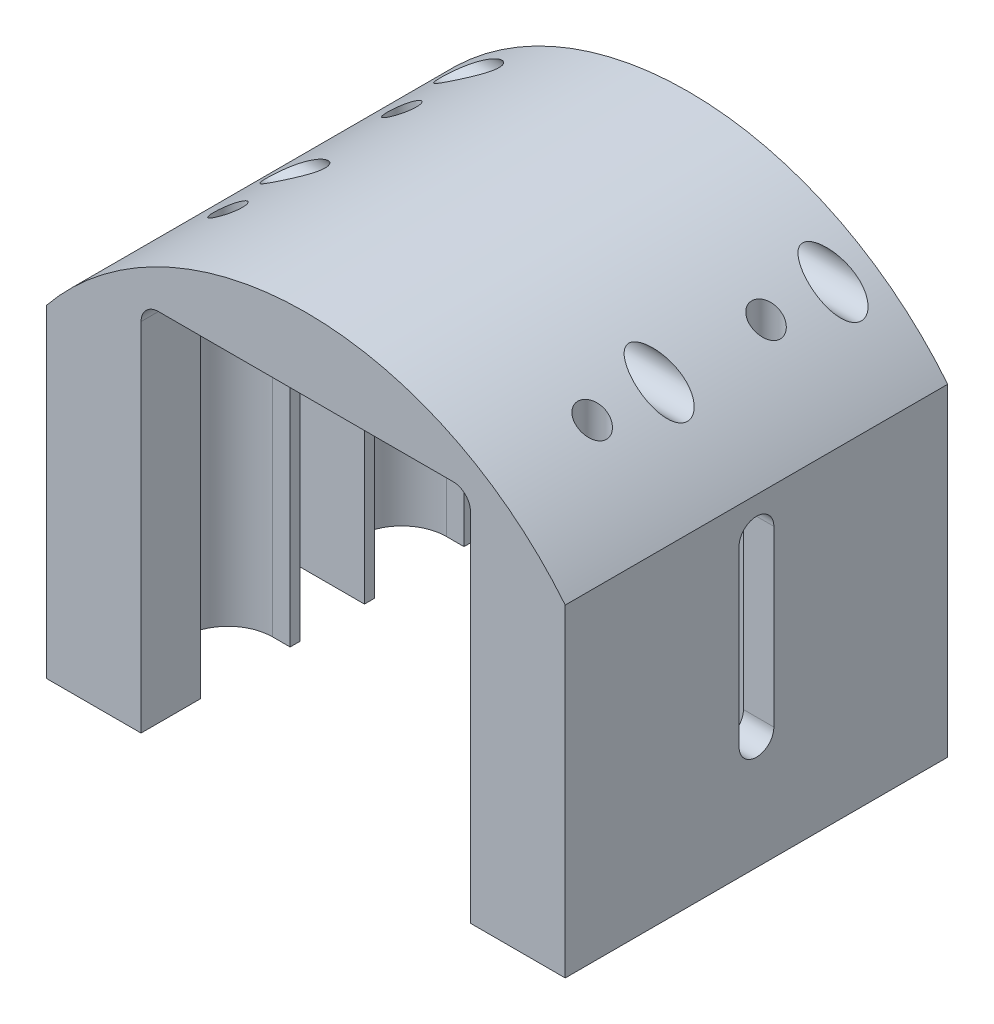
from build123d import *

# Parameters (mm, degrees)
BOSS_EXTRUDE1_DEPTH     = 44
CUT_EXTRUDE1_DEPTH      = 66.586450582
SKETCH4_W               = 7.4
SKETCH4_H               = 7.4
CUT_EXTRUDE2_DEPTH      = 38
CUT_EXTRUDE4_DEPTH      = 66.586450582
CUT_EXTRUDE4_DEPTH_BACK = 66.586450582
BOSS_EXTRUDE2_START     = -48.736492
BOSS_EXTRUDE2_DEPTH     = 37.772984
CUT_EXTRUDE5_DEPTH      = 84.514370074
SKETCH8_R               = 1.65
CUT_EXTRUDE6_DEPTH      = 66.353060485


with BuildPart() as part:
    # Sketch1 → Boss-Extrude1 (new body)
    with BuildSketch(Plane.XY):
        with BuildLine():
            Line((29.85, -13), (29.85, 24.156520859))
            ThreePointArc((29.85, 24.156520859), (0, 38.4), (-29.85, 24.156520859))
            Line((-29.85, 24.156520859), (-29.85, -13))
            Line((-29.85, -13), (29.85, -13))
        make_face()
    extrude(amount=BOSS_EXTRUDE1_DEPTH)

    # Sketch2 → Cut-Extrude1 (cut, through all)
    with BuildSketch(Plane.XY.offset(44)):
        with BuildLine():
            Line((18.95, 0), (18.95, -33.398465534))
            ThreePointArc((18.95, -33.398465534), (0, -38.4), (-18.95, -33.398465534))
            Line((-18.95, -33.398465534), (-18.95, 0))
            Line((-18.95, 0), (-18.95, 28))
            ThreePointArc((-18.95, 28), (-18.364213562, 29.414213562), (-16.95, 30))
            Line((-16.95, 30), (16.95, 30))
            ThreePointArc((16.95, 30), (18.364213562, 29.414213562), (18.95, 28))
            Line((18.95, 28), (18.95, 0))
        make_face()
    extrude(amount=-CUT_EXTRUDE1_DEPTH, mode=Mode.SUBTRACT)

    # Sketch4 → Cut-Extrude2 (cut)
    with BuildSketch(Plane(origin=(0, -13, 0), x_dir=(-1, 0, 0), z_dir=(0, -1, 0))):
        with BuildLine():
            ThreePointArc((26.1, -32), (24.591599923, -28.358400077), (20.95, -26.85))
            ThreePointArc((20.95, -26.85), (19.929780948, -26.952064473), (18.95, -27.254212394))
            Line((18.95, -27.254212394), (18.95, -36.745787606))
            ThreePointArc((18.95, -36.745787606), (19.929780948, -37.047935527), (20.95, -37.15))
            ThreePointArc((20.95, -37.15), (24.591599923, -35.641599923), (26.1, -32))
        make_face()
        with BuildLine():
            Line((18.95, -36.745787606), (18.95, -27.254212394))
            ThreePointArc((18.95, -27.254212394), (15.8, -32), (18.95, -36.745787606))
        make_face()
        with BuildLine():
            ThreePointArc((20.95, -37.15), (19.929780948, -37.047935527), (18.95, -36.745787606))
            Line((18.95, -36.745787606), (18.95, -37.15))
            Line((18.95, -37.15), (20.95, -37.15))
        make_face()
        with BuildLine():
            Line((20.95, -26.85), (18.95, -26.85))
            Line((18.95, -26.85), (18.95, -27.254212394))
            ThreePointArc((18.95, -27.254212394), (19.929780948, -26.952064473), (20.95, -26.85))
        make_face()
        with BuildLine():
            ThreePointArc((26.1, -12), (24.591599923, -8.358400077), (20.95, -6.85))
            ThreePointArc((20.95, -6.85), (19.929780948, -6.952064473), (18.95, -7.254212394))
            Line((18.95, -7.254212394), (18.95, -16.745787606))
            ThreePointArc((18.95, -16.745787606), (19.929780948, -17.047935527), (20.95, -17.15))
            ThreePointArc((20.95, -17.15), (24.591599923, -15.641599923), (26.1, -12))
        make_face()
        with BuildLine():
            Line((18.95, -16.745787606), (18.95, -7.254212394))
            ThreePointArc((18.95, -7.254212394), (15.8, -12), (18.95, -16.745787606))
        make_face()
        with BuildLine():
            Line((18.95, -17.15), (20.95, -17.15))
            ThreePointArc((20.95, -17.15), (19.929780948, -17.047935527), (18.95, -16.745787606))
            Line((18.95, -16.745787606), (18.95, -17.15))
        make_face()
        with BuildLine():
            ThreePointArc((18.95, -7.254212394), (19.929780948, -6.952064473), (20.95, -6.85))
            Line((20.95, -6.85), (18.95, -6.85))
            Line((18.95, -6.85), (18.95, -7.254212394))
        make_face()
        with BuildLine():
            ThreePointArc((-20.95, -26.85), (-26.1, -32), (-20.95, -37.15))
            ThreePointArc((-20.95, -37.15), (-19.929780948, -37.047935527), (-18.95, -36.745787606))
            Line((-18.95, -36.745787606), (-18.95, -27.254212394))
            ThreePointArc((-18.95, -27.254212394), (-19.929780948, -26.952064473), (-20.95, -26.85))
        make_face()
        with BuildLine():
            Line((-18.95, -27.254212394), (-18.95, -36.745787606))
            ThreePointArc((-18.95, -36.745787606), (-16.659166748, -34.848025632), (-15.8, -32))
            ThreePointArc((-15.8, -32), (-16.659166748, -29.151974368), (-18.95, -27.254212394))
        make_face()
        with BuildLine():
            ThreePointArc((-18.95, -36.745787606), (-19.929780948, -37.047935527), (-20.95, -37.15))
            Line((-20.95, -37.15), (-18.95, -37.15))
            Line((-18.95, -37.15), (-18.95, -36.745787606))
        make_face()
        with BuildLine():
            ThreePointArc((-20.95, -6.85), (-26.1, -12), (-20.95, -17.15))
            ThreePointArc((-20.95, -17.15), (-19.929780948, -17.047935527), (-18.95, -16.745787606))
            Line((-18.95, -16.745787606), (-18.95, -7.254212394))
            ThreePointArc((-18.95, -7.254212394), (-19.929780948, -6.952064473), (-20.95, -6.85))
        make_face()
        with BuildLine():
            Line((-18.95, -7.254212394), (-18.95, -16.745787606))
            ThreePointArc((-18.95, -16.745787606), (-16.659166748, -14.848025632), (-15.8, -12))
            ThreePointArc((-15.8, -12), (-16.659166748, -9.151974368), (-18.95, -7.254212394))
        make_face()
        with BuildLine():
            Line((-20.95, -17.15), (-18.95, -17.15))
            Line((-18.95, -17.15), (-18.95, -16.745787606))
            ThreePointArc((-18.95, -16.745787606), (-19.929780948, -17.047935527), (-20.95, -17.15))
        make_face()
        with BuildLine():
            Line((-18.95, -6.85), (-20.95, -6.85))
            ThreePointArc((-20.95, -6.85), (-19.929780948, -6.952064473), (-18.95, -7.254212394))
            Line((-18.95, -7.254212394), (-18.95, -6.85))
        make_face()
        with Locations((-22.65, -22)):
            Rectangle(SKETCH4_W, SKETCH4_H)
        with Locations((22.65, -22)):
            Rectangle(SKETCH4_W, SKETCH4_H)
        with BuildLine():
            Line((-18.95, -26.85), (-20.95, -26.85))
            ThreePointArc((-20.95, -26.85), (-19.929780948, -26.952064473), (-18.95, -27.254212394))
            Line((-18.95, -27.254212394), (-18.95, -26.85))
        make_face()
    extrude(amount=-CUT_EXTRUDE2_DEPTH, mode=Mode.SUBTRACT)

    # Sketch6 → Cut-Extrude4 (cut, two sides: drawn at the far end of the back side and taken through both)
    with BuildSketch(Plane(origin=(0, 0, 0), x_dir=(0, 0, -1), z_dir=(1, 0, 0)).offset(-CUT_EXTRUDE4_DEPTH_BACK)):
        with BuildLine():
            Line((-20, 20), (-20, 0))
            ThreePointArc((-20, 0), (-22, -2), (-24, 0))
            Line((-24, 0), (-24, 20))
            ThreePointArc((-24, 20), (-22, 22), (-20, 20))
        make_face()
    extrude(amount=CUT_EXTRUDE4_DEPTH + CUT_EXTRUDE4_DEPTH_BACK, mode=Mode.SUBTRACT)

    # Sketch7 → Boss-Extrude2 (add)
    with BuildSketch(Plane(origin=(29.85, 0, 0), x_dir=(0, 0, -1), z_dir=(1, 0, 0)).offset(BOSS_EXTRUDE2_START)):
        with BuildLine():
            ThreePointArc((-7.8, 32), (-4.3, 28.5), (-0.8, 32))
            Line((-0.8, 32), (-2.1, 32))
            ThreePointArc((-2.1, 32), (-4.3, 29.8), (-6.5, 32))
            Line((-6.5, 32), (-7.8, 32))
        make_face()
        with BuildLine():
            ThreePointArc((-27.8, 32), (-24.3, 28.5), (-20.8, 32))
            Line((-20.8, 32), (-22.1, 32))
            ThreePointArc((-22.1, 32), (-24.3, 29.8), (-26.5, 32))
            Line((-26.5, 32), (-27.8, 32))
        make_face()
    extrude(amount=BOSS_EXTRUDE2_DEPTH)

    # Sketch7<3> → Cut-Extrude5 (cut, through all)
    with BuildSketch(Plane(origin=(29.85, 0, 0), x_dir=(0, 0, -1), z_dir=(1, 0, 0))):
        with BuildLine():
            ThreePointArc((-26.5, 32), (-24.3, 29.8), (-22.1, 32))
            Line((-22.1, 32), (-26.5, 32))
        make_face()
        with BuildLine():
            Line((-26.5, 32), (-22.1, 32))
            ThreePointArc((-22.1, 32), (-24.3, 34.2), (-26.5, 32))
        make_face()
        with BuildLine():
            ThreePointArc((-6.5, 32), (-4.3, 29.8), (-2.1, 32))
            Line((-2.1, 32), (-6.5, 32))
        make_face()
        with BuildLine():
            Line((-6.5, 32), (-2.1, 32))
            ThreePointArc((-2.1, 32), (-4.3, 34.2), (-6.5, 32))
        make_face()
    extrude(amount=-CUT_EXTRUDE5_DEPTH, mode=Mode.SUBTRACT)

    # Sketch8 → Cut-Extrude6 (cut, through all)
    with BuildSketch(Plane.XZ.offset(-25)):
        with Locations(Location((-20.95, 32, 0), (0, 0, 270))):
            Circle(SKETCH8_R)
        with Locations(Location((20.95, 32, 0), (0, 0, 270))):
            Circle(SKETCH8_R)
        with Locations(Location((20.95, 12, 0), (0, 0, 270))):
            Circle(SKETCH8_R)
        with Locations(Location((-20.95, 12, 0), (0, 0, 270))):
            Circle(SKETCH8_R)
    extrude(amount=-CUT_EXTRUDE6_DEPTH, mode=Mode.SUBTRACT)


solid = part.part
